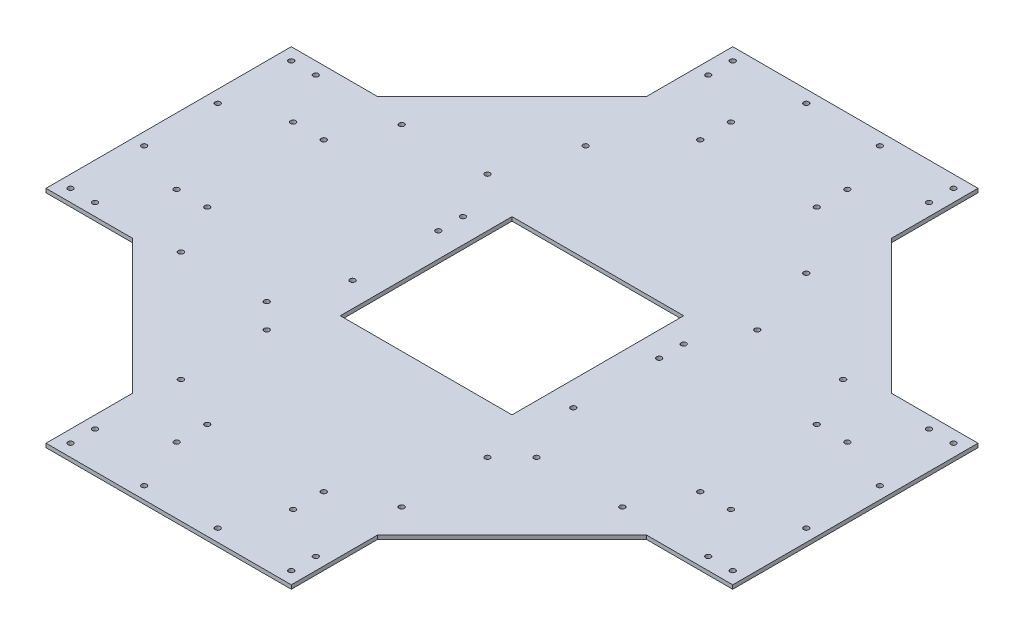
from build123d import *

# Parameters (mm, degrees)
SKETCH1_R           = 2.125
SKETCH1_W           = 140
SKETCH1_H           = 140
BOSS_EXTRUDE1_DEPTH = 3.175


with BuildPart() as part:
    # Sketch1 → Boss-Extrude1 (new body)
    with BuildSketch(Plane(origin=(0, 0, 0), x_dir=(1, 0, 0), z_dir=(0, 1, 0))):
        Polygon((-100, -280), (0, -280), (100, -280), (100, -209.601551084), (209.601551084, -100), (280, -100), (280, 0), (280, 100), (209.601551084, 100), (100, 209.601551084), (100, 280), (0, 280), (-100, 280), (-100, 209.601551084), (-209.601551084, 100), (-280, 100), (-280, 0), (-280, -100), (-209.601551084, -100), (-100, -209.601551084), align=None)
        with Locations((-90, -270)):
            Circle(SKETCH1_R, mode=Mode.SUBTRACT)
        with Locations((-90, -250)):
            Circle(SKETCH1_R, mode=Mode.SUBTRACT)
        with Locations((-30, -270)):
            Circle(SKETCH1_R, mode=Mode.SUBTRACT)
        with Locations((-47.5, -226)):
            Circle(SKETCH1_R, mode=Mode.SUBTRACT)
        with Locations((-90, -180)):
            Circle(SKETCH1_R, mode=Mode.SUBTRACT)
        with Locations((-47.5, -201)):
            Circle(SKETCH1_R, mode=Mode.SUBTRACT)
        with Locations((-270, -90)):
            Circle(SKETCH1_R, mode=Mode.SUBTRACT)
        with Locations((-250, -90)):
            Circle(SKETCH1_R, mode=Mode.SUBTRACT)
        with Locations((-180, -90)):
            Circle(SKETCH1_R, mode=Mode.SUBTRACT)
        with Locations((-226, -47.5)):
            Circle(SKETCH1_R, mode=Mode.SUBTRACT)
        with Locations((-270, -30)):
            Circle(SKETCH1_R, mode=Mode.SUBTRACT)
        with Locations((-201, -47.5)):
            Circle(SKETCH1_R, mode=Mode.SUBTRACT)
        with Locations((-90, -110)):
            Circle(SKETCH1_R, mode=Mode.SUBTRACT)
        with Locations((-110, -90)):
            Circle(SKETCH1_R, mode=Mode.SUBTRACT)
        with Locations((-90, -40)):
            Circle(SKETCH1_R, mode=Mode.SUBTRACT)
        with Locations((30, -270)):
            Circle(SKETCH1_R, mode=Mode.SUBTRACT)
        with Locations((47.5, -226)):
            Circle(SKETCH1_R, mode=Mode.SUBTRACT)
        with Locations((90, -270)):
            Circle(SKETCH1_R, mode=Mode.SUBTRACT)
        with Locations((90, -250)):
            Circle(SKETCH1_R, mode=Mode.SUBTRACT)
        with Locations((47.5, -201)):
            Circle(SKETCH1_R, mode=Mode.SUBTRACT)
        with Locations((90, -180)):
            Circle(SKETCH1_R, mode=Mode.SUBTRACT)
        with Locations((90, -110)):
            Circle(SKETCH1_R, mode=Mode.SUBTRACT)
        with Locations((110, -90)):
            Circle(SKETCH1_R, mode=Mode.SUBTRACT)
        with Locations((90, -40)):
            Circle(SKETCH1_R, mode=Mode.SUBTRACT)
        with Locations((180, -90)):
            Circle(SKETCH1_R, mode=Mode.SUBTRACT)
        with Locations((250, -90)):
            Circle(SKETCH1_R, mode=Mode.SUBTRACT)
        with Locations((270, -90)):
            Circle(SKETCH1_R, mode=Mode.SUBTRACT)
        with Locations((201, -47.5)):
            Circle(SKETCH1_R, mode=Mode.SUBTRACT)
        with Locations((226, -47.5)):
            Circle(SKETCH1_R, mode=Mode.SUBTRACT)
        with Locations((270, -30)):
            Circle(SKETCH1_R, mode=Mode.SUBTRACT)
        with Locations((-270, 30)):
            Circle(SKETCH1_R, mode=Mode.SUBTRACT)
        with Locations((-226, 47.5)):
            Circle(SKETCH1_R, mode=Mode.SUBTRACT)
        with Locations((-201, 47.5)):
            Circle(SKETCH1_R, mode=Mode.SUBTRACT)
        with Locations((-270, 90)):
            Circle(SKETCH1_R, mode=Mode.SUBTRACT)
        with Locations((-250, 90)):
            Circle(SKETCH1_R, mode=Mode.SUBTRACT)
        with Locations((-180, 90)):
            Circle(SKETCH1_R, mode=Mode.SUBTRACT)
        with Locations((-90, 30)):
            Circle(SKETCH1_R, mode=Mode.SUBTRACT)
        with Locations((-90, 50)):
            Circle(SKETCH1_R, mode=Mode.SUBTRACT)
        Rectangle(SKETCH1_W, SKETCH1_H, mode=Mode.SUBTRACT)
        with Locations((-110, 90)):
            Circle(SKETCH1_R, mode=Mode.SUBTRACT)
        with Locations((-90, 150)):
            Circle(SKETCH1_R, mode=Mode.SUBTRACT)
        with Locations((-47.5, 201)):
            Circle(SKETCH1_R, mode=Mode.SUBTRACT)
        with Locations((-90, 250)):
            Circle(SKETCH1_R, mode=Mode.SUBTRACT)
        with Locations((-90, 270)):
            Circle(SKETCH1_R, mode=Mode.SUBTRACT)
        with Locations((-47.5, 226)):
            Circle(SKETCH1_R, mode=Mode.SUBTRACT)
        with Locations((-30, 270)):
            Circle(SKETCH1_R, mode=Mode.SUBTRACT)
        with Locations((90, 30)):
            Circle(SKETCH1_R, mode=Mode.SUBTRACT)
        with Locations((90, 50)):
            Circle(SKETCH1_R, mode=Mode.SUBTRACT)
        with Locations((110, 90)):
            Circle(SKETCH1_R, mode=Mode.SUBTRACT)
        with Locations((201, 47.5)):
            Circle(SKETCH1_R, mode=Mode.SUBTRACT)
        with Locations((270, 30)):
            Circle(SKETCH1_R, mode=Mode.SUBTRACT)
        with Locations((226, 47.5)):
            Circle(SKETCH1_R, mode=Mode.SUBTRACT)
        with Locations((180, 90)):
            Circle(SKETCH1_R, mode=Mode.SUBTRACT)
        with Locations((250, 90)):
            Circle(SKETCH1_R, mode=Mode.SUBTRACT)
        with Locations((270, 90)):
            Circle(SKETCH1_R, mode=Mode.SUBTRACT)
        with Locations((47.5, 201)):
            Circle(SKETCH1_R, mode=Mode.SUBTRACT)
        with Locations((90, 150)):
            Circle(SKETCH1_R, mode=Mode.SUBTRACT)
        with Locations((47.5, 226)):
            Circle(SKETCH1_R, mode=Mode.SUBTRACT)
        with Locations((30, 270)):
            Circle(SKETCH1_R, mode=Mode.SUBTRACT)
        with Locations((90, 250)):
            Circle(SKETCH1_R, mode=Mode.SUBTRACT)
        with Locations((90, 270)):
            Circle(SKETCH1_R, mode=Mode.SUBTRACT)
    extrude(amount=BOSS_EXTRUDE1_DEPTH)


solid = part.part
